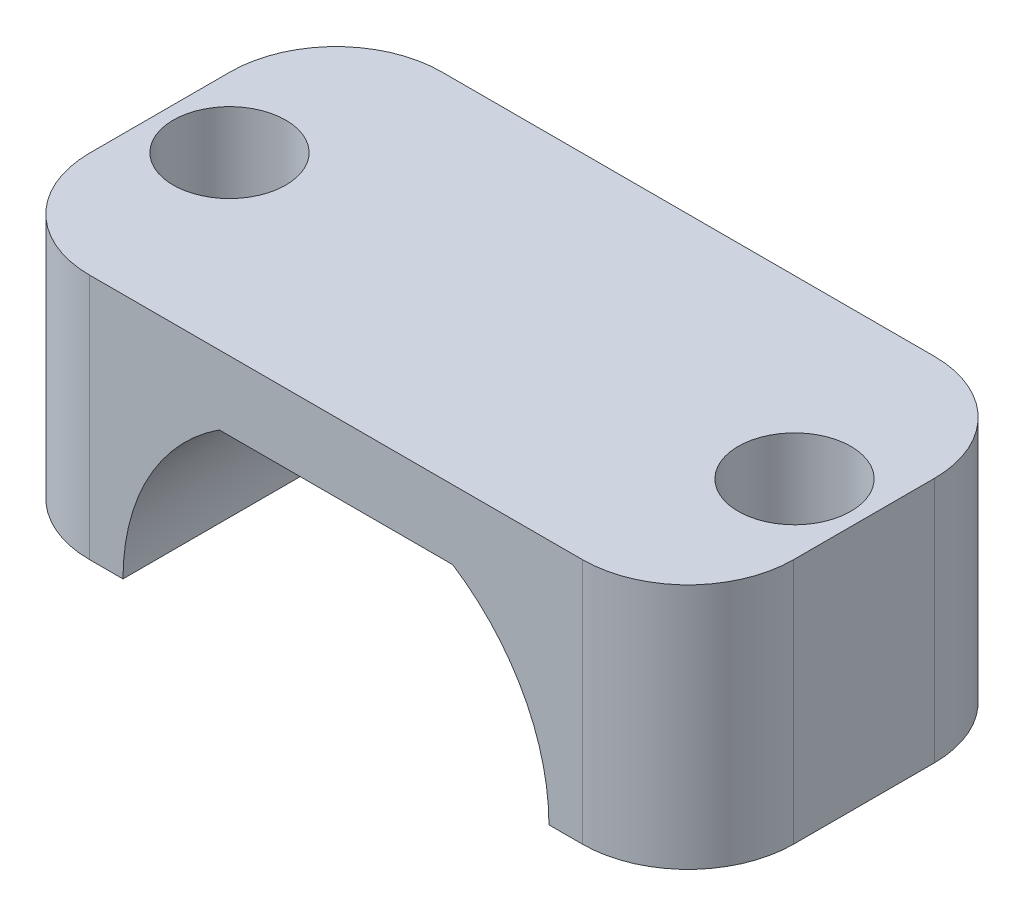
from build123d import *

# Parameters (mm, degrees)
BOSS_EXTRUDE1_DEPTH = 5
SKETCH2_R           = 1.6
CUT_EXTRUDE1_DEPTH  = 14.190905958
FILLET3_R           = 3


with BuildPart() as part:
    # Sketch1 → Boss-Extrude1 (new, symmetric)
    with BuildSketch(Plane.XY):
        with BuildLine():
            Line((-10, 0), (10, 0))
            Line((10, 0), (10, -7))
            Line((10, -7), (6.05, -7))
            ThreePointArc((6.05, -7), (5.322096357, -4.135562883), (3.315, -1.966137169))
            Line((3.315, -1.966137169), (-3.315, -1.966137169))
            ThreePointArc((-3.315, -1.966137169), (-5.322096357, -4.135562883), (-6.05, -7))
            Line((-6.05, -7), (-10, -7))
            Line((-10, -7), (-10, 0))
        make_face()
    extrude(amount=BOSS_EXTRUDE1_DEPTH, both=True)

    # Sketch2 → Cut-Extrude1 (cut, through all)
    with BuildSketch(Plane.XZ.offset(7)):
        with Locations((8.025, 0)):
            Circle(SKETCH2_R)
        with Locations((-8.025, 0)):
            Circle(SKETCH2_R)
    extrude(amount=-CUT_EXTRUDE1_DEPTH, mode=Mode.SUBTRACT)

    # Fillet3
    fillet3_edges = [part.edges().sort_by_distance(p)[0] for p in [
        (10, -3.5, -5),
        (10, -3.5, 5),
        (-10, -3.5, -5),
        (-10, -3.5, 5),
    ]]
    fillet(fillet3_edges, radius=FILLET3_R)


solid = part.part
